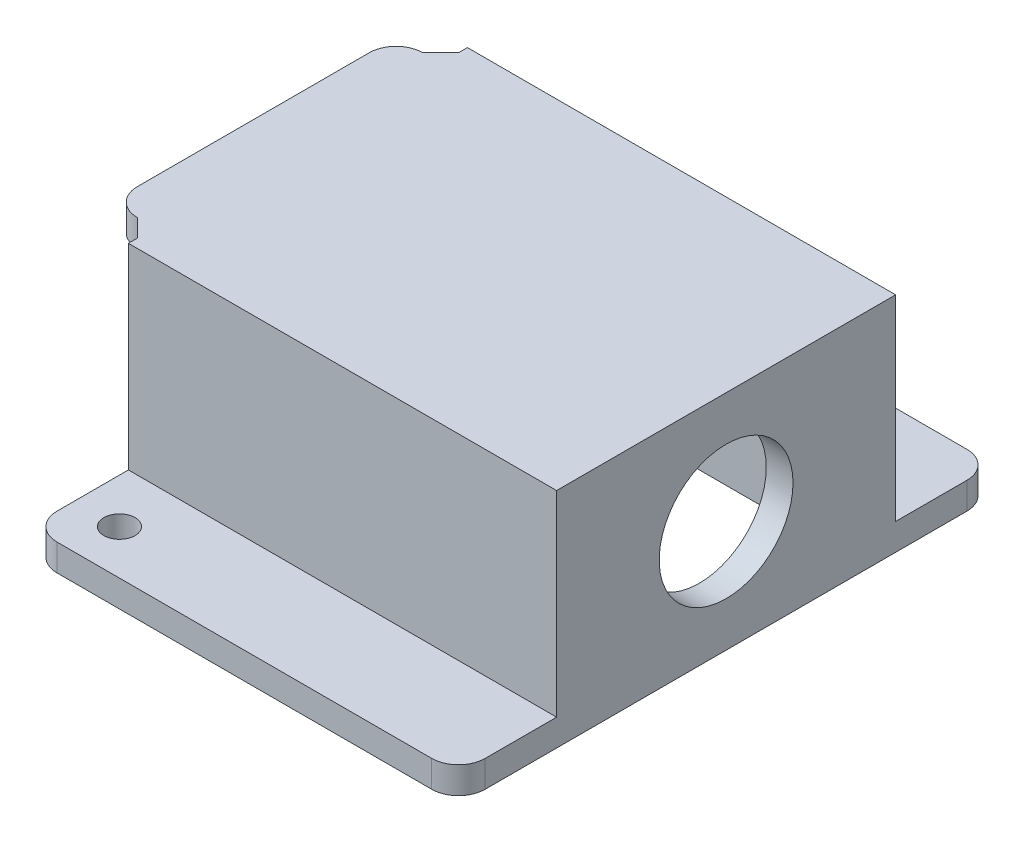
from build123d import *

# Parameters (mm, degrees)
SKETCH_1_W          = 53
SKETCH_1_H          = 60
EXTRUDE_1_DEPTH     = 3
EXTRUDE_2_DEPTH     = 22
SKETCH_3_W          = 32
SKETCH_3_H          = 3
EXTRUDE_3_DEPTH     = 50
CUT_EXTRUDE_1_DEPTH = 5
SKETCH_6_W          = 32
SKETCH_6_H          = 3
CUT_EXTRUDE_2_DEPTH = 45
SKETCH_7_R          = 7.5
CUT_EXTRUDE_3_DEPTH = 45
SKETCH_8_R          = 1.75
CUT_EXTRUDE_4_DEPTH = 45
FILLET_1_R          = 3
CHAMFER_1_SIZE      = 2


with BuildPart() as part:
    # 草图1 → 凸台-拉伸1 (new body)
    with BuildSketch(Plane(origin=(0, 0, 0), x_dir=(1, 0, 0), z_dir=(0, 1, 0))):
        with Locations((26.5, 30)):
            Rectangle(SKETCH_1_W, SKETCH_1_H)
    extrude(amount=EXTRUDE_1_DEPTH)

    # 草图2 → 凸台-拉伸2 (add)
    with BuildSketch(Plane(origin=(0, 3, 0), x_dir=(1, 0, 0), z_dir=(0, 1, 0))):
        Polygon((0, 49), (53, 49), (53, 11), (0, 11), (0, 14), (50, 14), (50, 46), (0, 46), align=None)
    extrude(amount=EXTRUDE_2_DEPTH)

    # 草图3 → 凸台-拉伸3 (add)
    with BuildSketch(Plane.ZY.offset(-50)):
        with Locations((-30, 23.5)):
            Rectangle(SKETCH_3_W, SKETCH_3_H)
    extrude(amount=EXTRUDE_3_DEPTH)

    # 草图5 → 切除-拉伸1 (cut)
    with BuildSketch(Plane.ZY):
        Polygon((-49, 25), (-49, 3), (-60, 3), (-60, 0), (0, 0), (0, 3), (-11, 3), (-11, 25), (-14, 25), (-14, 22), (-46, 22), (-46, 25), align=None)
    extrude(amount=-CUT_EXTRUDE_1_DEPTH, mode=Mode.SUBTRACT)

    # 草图6 → 切除-拉伸2 (cut)
    with BuildSketch(Plane.ZY.offset(-5)):
        with Locations((-30, 1.5)):
            Rectangle(SKETCH_6_W, SKETCH_6_H)
    extrude(amount=-CUT_EXTRUDE_2_DEPTH, mode=Mode.SUBTRACT)

    # 草图7 → 切除-拉伸3 (cut)
    with BuildSketch(Plane(origin=(53, 0, 0), x_dir=(0, 0, -1), z_dir=(1, 0, 0))):
        with Locations((30, 12.5)):
            Circle(SKETCH_7_R)
    extrude(amount=-CUT_EXTRUDE_3_DEPTH, mode=Mode.SUBTRACT)

    # 草图8 → 切除-拉伸4 (cut)
    with BuildSketch(Plane.XZ):
        with Locations(Location((10, -5, 0), (0, 0, 270))):
            Circle(SKETCH_8_R)
        with Locations(Location((10, -55, 0), (0, 0, 270))):
            Circle(SKETCH_8_R)
    extrude(amount=-CUT_EXTRUDE_4_DEPTH, mode=Mode.SUBTRACT)

    # 圆角1
    fillet_1_edges = [part.edges().sort_by_distance(p)[0] for p in [
        (0, 23.5, -46),
        (0, 23.5, -14),
        (5, 1.5, 0),
        (5, 1.5, -60),
        (53, 1.5, -60),
        (53, 1.5, 0),
    ]]
    fillet(fillet_1_edges, radius=FILLET_1_R)

    # 倒角1
    chamfer_1_edges = [part.edges().sort_by_distance(p)[0] for p in [
        (5, 23.5, -46),
        (5, 23.5, -14),
    ]]
    chamfer(chamfer_1_edges, length=CHAMFER_1_SIZE - 0.0001)  # a hair under: the kernel refuses the full size


solid = part.part
